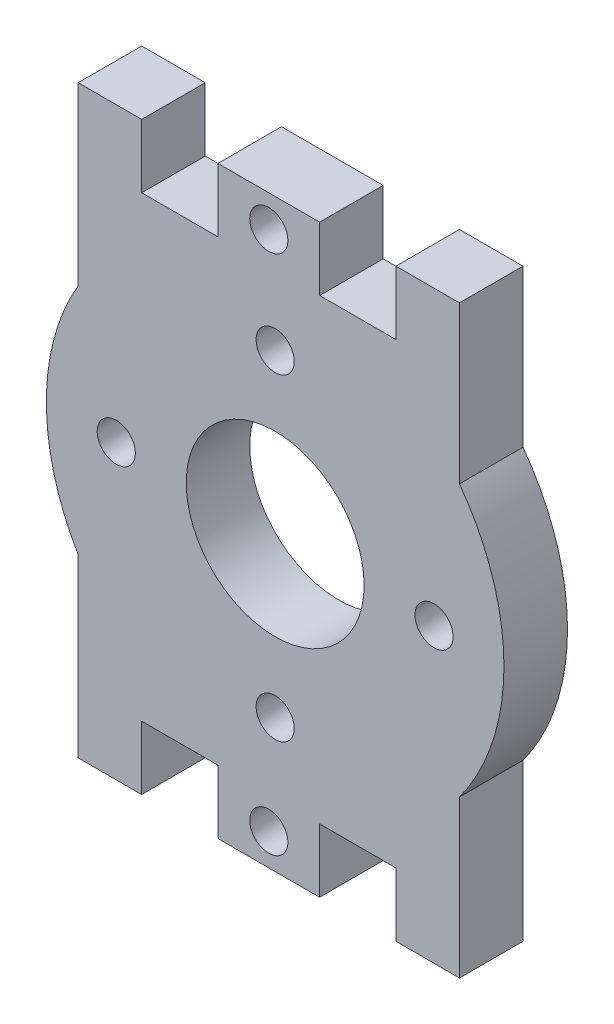
from build123d import *

# Parameters (mm, degrees)
SKETCH1_R           = 7
SKETCH1_R_2         = 1.5
BOSS_EXTRUDE1_DEPTH = 5
SKETCH3_W           = 2.5
SKETCH3_H           = 12.334635496
SKETCH3_W_2         = 5
SKETCH3_H_2         = 13.848497391
BOSS_EXTRUDE2_DEPTH = 5


with BuildPart() as part:
    # Sketch1 → Boss-Extrude1 (new body)
    with BuildSketch(Plane.XY):
        with BuildLine():
            Line((12, 23), (9.5, 23))
            Line((9.5, 23), (9.5, 18))
            Line((9.5, 18), (3.5, 18))
            Line((3.5, 18), (3.5, 23))
            Line((3.5, 23), (-4.5, 23))
            Line((-4.5, 23), (-4.5, 18))
            Line((-4.5, 18), (-10.5, 18))
            Line((-10.5, 18), (-10.5, 23))
            Line((-10.5, 23), (-12, 23))
            Line((-12, 23), (-12, 13.416407865))
            ThreePointArc((-12, 13.416407865), (-18, 0), (-12, -13.416407865))
            Line((-12, -13.416407865), (-12, -23))
            Line((-12, -23), (-10.5, -23))
            Line((-10.5, -23), (-10.5, -18))
            Line((-10.5, -18), (-4.5, -18))
            Line((-4.5, -18), (-4.5, -23))
            Line((-4.5, -23), (3.5, -23))
            Line((3.5, -23), (3.5, -18))
            Line((3.5, -18), (9.5, -18))
            Line((9.5, -18), (9.5, -23))
            Line((9.5, -23), (12, -23))
            Line((12, -23), (12, -13.416407865))
            ThreePointArc((12, -13.416407865), (18, 0), (12, 13.416407865))
            Line((12, 13.416407865), (12, 23))
        make_face()
        Circle(SKETCH1_R, mode=Mode.SUBTRACT)
        with Locations((0, -12.5)):
            Circle(SKETCH1_R_2, mode=Mode.SUBTRACT)
        with Locations((-12.5, 0)):
            Circle(SKETCH1_R_2, mode=Mode.SUBTRACT)
        with Locations((0, 12.5)):
            Circle(SKETCH1_R_2, mode=Mode.SUBTRACT)
        with Locations((12.5, 0)):
            Circle(SKETCH1_R_2, mode=Mode.SUBTRACT)
        with Locations((-0.5, -20.5)):
            Circle(SKETCH1_R_2, mode=Mode.SUBTRACT)
        with Locations((-0.5, 20.5)):
            Circle(SKETCH1_R_2, mode=Mode.SUBTRACT)
    extrude(amount=BOSS_EXTRUDE1_DEPTH)

    # Sketch3 → Boss-Extrude2 (add)
    with BuildSketch(Plane(origin=(0, 0, 0), x_dir=(-1, 0, 0), z_dir=(0, 0, -1))):
        with Locations((-13.25, 16.832682252)):
            Rectangle(SKETCH3_W, SKETCH3_H)
        with Locations((13, 16.075751305)):
            Rectangle(SKETCH3_W_2, SKETCH3_H_2)
    boss_extrude2 = extrude(amount=-BOSS_EXTRUDE2_DEPTH)

    # Mirror1: Boss-Extrude2 across plane
    add(boss_extrude2.mirror(Plane.ZX))


solid = part.part
